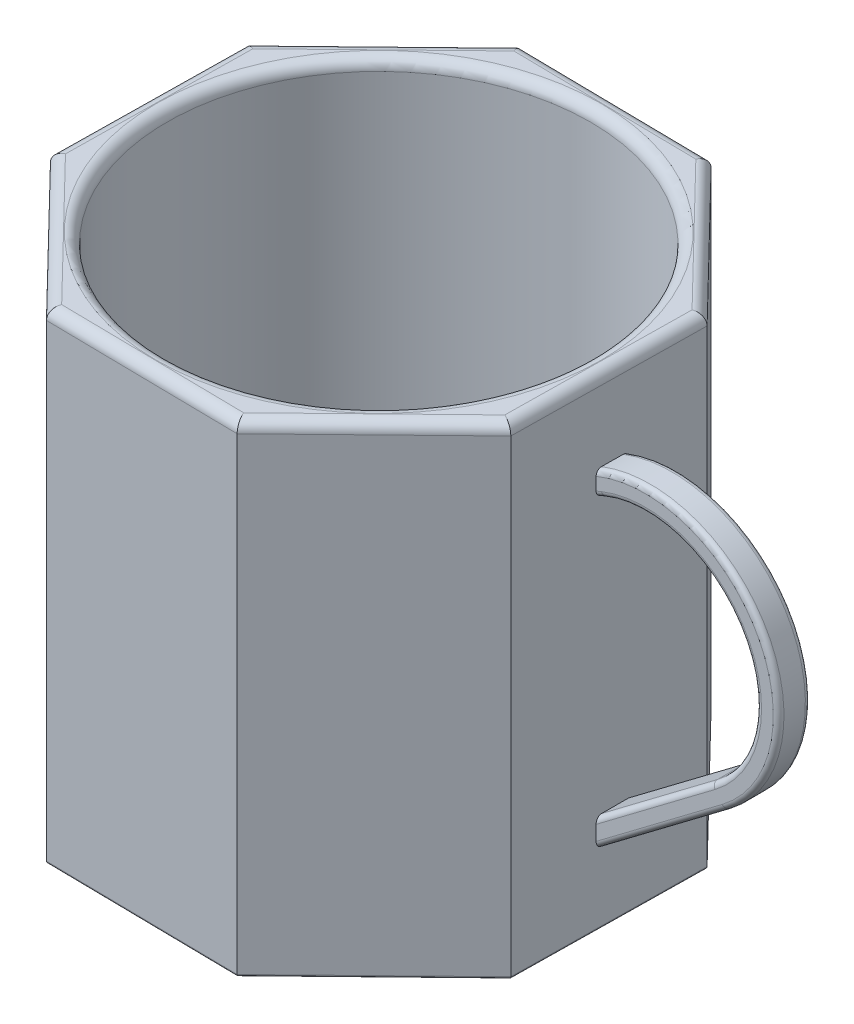
from build123d import *

# Parameters (mm, degrees)
BOSS_EXTRUDE1_DEPTH = 45
SKETCH2_R           = 19.8
CUT_EXTRUDE1_DEPTH  = 42
CUT_EXTRUDE2_START  = -1.5
SKETCH3_R           = 19.8
CUT_EXTRUDE2_DEPTH  = 1.5
FILLET1_R           = 1
FILLET2_R           = 0.5
FILLET3_R           = 1
FILLET4_R           = 1
BOSS_EXTRUDE2_DEPTH = 1.5
FILLET5_R           = 0.2
FILLET6_R           = 0.5
FILLET7_R           = 0.5


with BuildPart() as part:
    # Sketch1 → Boss-Extrude1 (new body)
    with BuildSketch(Plane(origin=(0, 0, 0), x_dir=(1, 0, 0), z_dir=(0, 1, 0))):
        Polygon((8.732802634, -21.98002019), (21.717245289, -9.367197366), (21.98002019, 8.732802634), (9.367197366, 21.717245289), (-8.732802634, 21.98002019), (-21.717245289, 9.367197366), (-21.98002019, -8.732802634), (-9.367197366, -21.717245289), align=None)
    extrude(amount=BOSS_EXTRUDE1_DEPTH)

    # Sketch2 → Cut-Extrude1 (cut)
    with BuildSketch(Plane(origin=(0, 45, 0), x_dir=(1, 0, 0), z_dir=(0, 1, 0))):
        with Locations(Location((0, 0, 0), (0, 0, 270))):
            Circle(SKETCH2_R)
    extrude(amount=-CUT_EXTRUDE1_DEPTH, mode=Mode.SUBTRACT)

    # Sketch3 → Cut-Extrude2 (cut)
    with BuildSketch(Plane.XZ.offset(CUT_EXTRUDE2_START)):
        with Locations(Location((0, 0, 0), (0, 0, 90))):
            Circle(SKETCH3_R)
    extrude(amount=CUT_EXTRUDE2_DEPTH, mode=Mode.SUBTRACT)

    # Fillet1
    fillet1_edges = [part.edges().sort_by_distance(p)[0] for p in [
        (0, 0, -19.8),
    ]]
    fillet(fillet1_edges, radius=FILLET1_R)

    # Fillet2
    fillet2_edges = [part.edges().sort_by_distance(p)[0] for p in [
        (0, 1.5, -19.8),
    ]]
    fillet(fillet2_edges, radius=FILLET2_R - 0.0001)  # a hair under: the kernel refuses the full size

    # Fillet3
    fillet3_edges = [part.edges().sort_by_distance(p)[0] for p in [
        (21.848632739, 45, 0.317197366),
        (15.673608778, 45, -15.225023962),
        (0.317197366, 45, -21.848632739),
        (-15.225023962, 45, -15.673608778),
        (-21.848632739, 45, -0.317197366),
        (-15.673608778, 45, 15.225023962),
        (-0.317197366, 45, 21.848632739),
        (15.225023962, 45, 15.673608778),
    ]]
    fillet(fillet3_edges, radius=FILLET3_R)

    # Fillet4
    fillet4_edges = [part.edges().sort_by_distance(p)[0] for p in [
        (0, 45, -19.8),
    ]]
    fillet(fillet4_edges, radius=FILLET4_R)

    # Sketch4 → Boss-Extrude2 (add, symmetric)
    with BuildSketch(Plane.XY):
        with BuildLine():
            Line((21.717245289, 6.575350598), (33.933777265, 15.786558253))
            ThreePointArc((33.933777265, 15.786558253), (37.284614612, 31.928177441), (21.717245289, 37.353764349))
            ThreePointArc((21.717245289, 37.353764349), (21.300504514, 37.172559686), (20.8935235, 36.970385359))
            Line((20.8935235, 36.970385359), (21.490631851, 34.963416872))
            ThreePointArc((21.490631851, 34.963416872), (21.994919911, 35.192343489), (22.505339257, 35.407252623))
            ThreePointArc((22.505339257, 35.407252623), (35.457390534, 30.893164316), (32.669493861, 17.463337152))
            Line((32.669493861, 17.463337152), (20.452961885, 8.252129496))
            ThreePointArc((20.452961885, 8.252129496), (20.246714138, 6.781598345), (21.717245289, 6.575350598))
        make_face()
    extrude(amount=BOSS_EXTRUDE2_DEPTH, both=True)

    # Fillet5
    fillet5_edges = [part.edges().sort_by_distance(p)[0] for p in [
        (15.673608778, 0, -15.225023962),
        (21.848632739, 0, 0.317197366),
        (15.225023962, 0, 15.673608778),
        (-0.317197366, 0, 21.848632739),
        (-15.673608778, 0, 15.225023962),
        (-21.848632739, 0, -0.317197366),
        (-15.225023962, 0, -15.673608778),
        (0.317197366, 0, -21.848632739),
    ]]
    fillet(fillet5_edges, radius=FILLET5_R)

    # Fillet6
    fillet6_edges = [part.edges().sort_by_distance(p)[0] for p in [
        (27.882619067, 11.224013431, 1.5),
        (27.904395993, 11.24043313, -1.5),
        (37.31478879, 31.874600745, 1.5),
        (37.326195009, 31.854186297, -1.5),
    ]]
    fillet(fillet6_edges, radius=FILLET6_R)

    # Fillet7
    fillet7_edges = [part.edges().sort_by_distance(p)[0] for p in [
        (27.250477366, 13.3774242, 1.5),
        (35.457390534, 30.893164316, 1.5),
        (22.167087746, 35.266692743, 1.5),
    ]]
    fillet(fillet7_edges, radius=FILLET7_R)


solid = part.part
